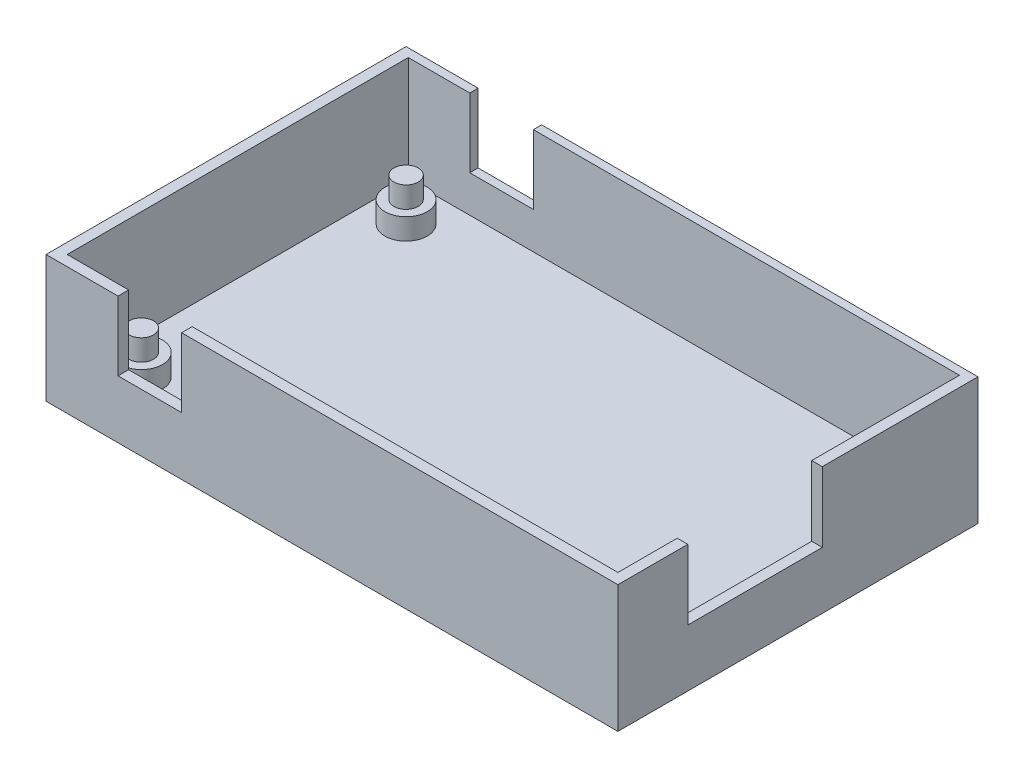
from build123d import *

# Parameters (mm, degrees)
SKETCH1_W           = 68.58
SKETCH1_H           = 43.18
BOSS_EXTRUDE1_DEPTH = 2.54
SKETCH5_R           = 2.54
BOSS_EXTRUDE2_DEPTH = 2.54
SKETCH6_W           = 68.58
SKETCH6_H           = 43.18
BOSS_EXTRUDE3_DEPTH = 12.7
SKETCH7_R           = 1.4605
BOSS_EXTRUDE4_DEPTH = 2.54
SKETCH8_W           = 7.62
SKETCH8_H           = 8.2856324
CUT_EXTRUDE1_DEPTH  = 83.46203005
SKETCH9_W           = 16.129
SKETCH9_H           = 8.382
CUT_EXTRUDE2_DEPTH  = 2.032


with BuildPart() as part:
    # Sketch1 → Boss-Extrude1 (new body)
    with BuildSketch(Plane(origin=(0, 0, 0), x_dir=(1, 0, 0), z_dir=(0, 1, 0))):
        with Locations((34.29, 21.59)):
            Rectangle(SKETCH1_W, SKETCH1_H)
    extrude(amount=BOSS_EXTRUDE1_DEPTH)

    # Sketch5 → Boss-Extrude2 (add)
    with BuildSketch(Plane(origin=(0, 2.54, 0), x_dir=(1, 0, 0), z_dir=(0, 1, 0))):
        with Locations((5.715, 37.465)):
            Circle(SKETCH5_R)
        with Locations((62.865, 37.465)):
            Circle(SKETCH5_R)
        with Locations((5.715, 5.715)):
            Circle(SKETCH5_R)
        with Locations((62.865, 5.715)):
            Circle(SKETCH5_R)
    extrude(amount=BOSS_EXTRUDE2_DEPTH)

    # Sketch6 → Boss-Extrude3 (add)
    with BuildSketch(Plane(origin=(0, 2.54, 0), x_dir=(1, 0, 0), z_dir=(0, 1, 0))):
        with Locations((34.29, 21.59)):
            Rectangle(SKETCH6_W, SKETCH6_H)
        Polygon((1.27, 42.171922196), (1.27, 1.27), (67.31, 1.27), (67.31, 42.229552983), align=None, mode=Mode.SUBTRACT)
    extrude(amount=BOSS_EXTRUDE3_DEPTH)

    # Sketch7 → Boss-Extrude4 (add)
    with BuildSketch(Plane(origin=(0, 5.08, 0), x_dir=(1, 0, 0), z_dir=(0, 1, 0))):
        with Locations((5.715, 37.465)):
            Circle(SKETCH7_R)
        with Locations((5.715, 5.715)):
            Circle(SKETCH7_R)
        with Locations((62.865, 5.715)):
            Circle(SKETCH7_R)
        with Locations((62.865, 37.465)):
            Circle(SKETCH7_R)
    extrude(amount=BOSS_EXTRUDE4_DEPTH)

    # Sketch8 → Cut-Extrude1 (cut, through all)
    with BuildSketch(Plane.XY):
        with Locations((12.446, 11.0971838)):
            Rectangle(SKETCH8_W, SKETCH8_H)
    extrude(amount=-CUT_EXTRUDE1_DEPTH, mode=Mode.SUBTRACT)

    # Sketch9 → Cut-Extrude2 (cut)
    with BuildSketch(Plane(origin=(68.58, 0, 0), x_dir=(0, 0, -1), z_dir=(1, 0, 0))):
        with Locations((16.4465, 11.049)):
            Rectangle(SKETCH9_W, SKETCH9_H)
    extrude(amount=-CUT_EXTRUDE2_DEPTH, mode=Mode.SUBTRACT)


solid = part.part
